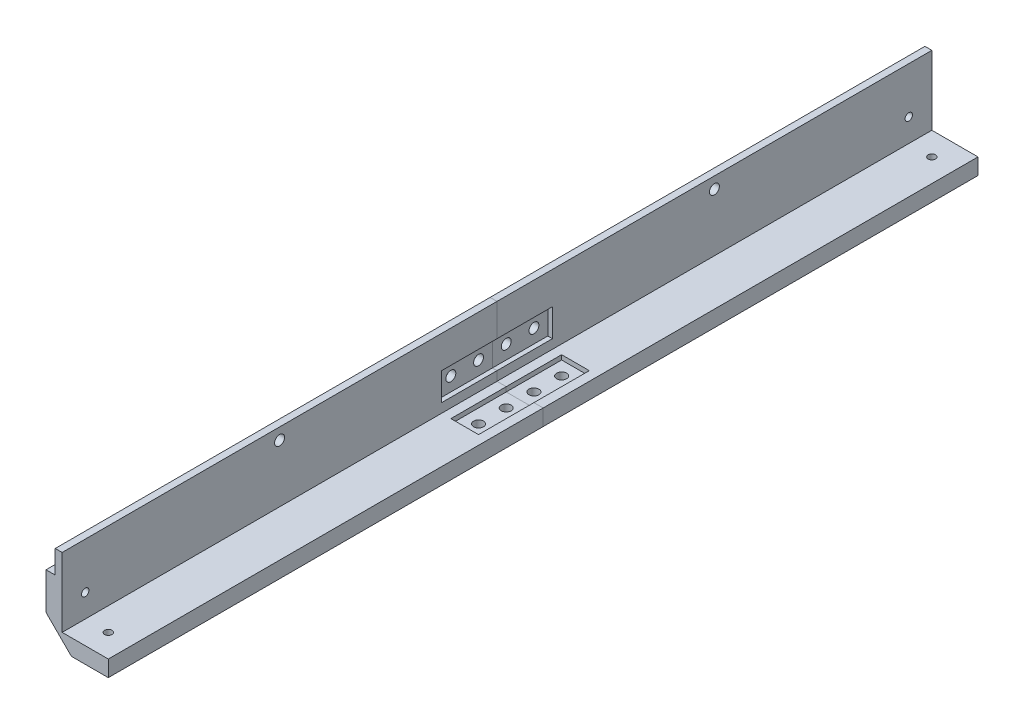
from build123d import *

# Parameters (mm, degrees)
BOSS_EXTRUDE1_DEPTH                = 188.45
FILLET1_R                          = 1.5
SKETCH6_W                          = 188.45
SKETCH6_H                          = 3
BOSS_EXTRUDE2_DEPTH                = 10
SKETCH7_W                          = 13
SKETCH7_H                          = 188.45
BOSS_EXTRUDE3_DEPTH                = 4
SKETCH8_W                          = 3
SKETCH8_H                          = 188.45
BOSS_EXTRUDE4_DEPTH                = 10
SKETCH9_W                          = 188.45
SKETCH9_H                          = 13
BOSS_EXTRUDE5_DEPTH                = 4
CSK_FOR_M3_SFHCS1_D                = 3.2
CSK_FOR_M3_SFHCS1_CSINK_D          = 6.72
CSK_FOR_M3_SFHCS1_CSINK_ANGLE      = 90
CSK_FOR_M3_SFHCS2_D                = 3.2
CSK_FOR_M3_SFHCS2_CSINK_D          = 6.72
CSK_FOR_M3_SFHCS2_CSINK_ANGLE      = 90
SKETCH14_W                         = 10
SKETCH14_H                         = 188.45
CUT_EXTRUDE1_DEPTH                 = 10
F_4_3_START                        = -3
F_4_3_4_3_DIAMETER_HOLE3_OUTLINE_R = 2.15
F_4_3_4_3_DIAMETER_HOLE3_DEPTH     = 3
SKETCH17_W                         = 12
SKETCH17_H                         = 48
CUT_EXTRUDE2_DEPTH                 = 2
SKETCH18_W                         = 48
SKETCH18_H                         = 12
CUT_EXTRUDE3_DEPTH                 = 2
F_4_3_START_2                      = -5
F_4_3_4_3_DIAMETER_HOLE1_OUTLINE_R = 2.15
F_4_3_4_3_DIAMETER_HOLE1_DEPTH     = 3
F_4_3_4_3_DIAMETER_HOLE2_OUTLINE_R = 2.15
F_4_3_4_3_DIAMETER_HOLE2_DEPTH     = 3


# Read off the part's stored shape, not the designer's step: Ø4.3 (4.3) Diameter Hole3, Ø4.3 (4.3) Diameter Hole1, Ø4.3 (4.3) Diameter Hole2
with BuildPart() as part:
    # Sketch1 → Boss-Extrude1 (new body)
    with BuildSketch(Plane.XY.offset(280)):
        Polygon((-7, 4), (4, -7), (7, -7), (7, -3), (20, -3), (20, 0), (0, 0), (0, 20), (-3, 20), (-3, 7), (-7, 7), align=None)
    extrude(amount=-BOSS_EXTRUDE1_DEPTH)

    # Fillet1
    fillet1_edges = [part.edges().sort_by_distance(p)[0] for p in [
        (4, -7, 185.775),
        (-7, 4, 185.775),
    ]]
    fillet(fillet1_edges, radius=FILLET1_R)

    # Sketch6 → Boss-Extrude2 (add)
    with BuildSketch(Plane(origin=(20, 0, 0), x_dir=(0, 0, -1), z_dir=(1, 0, 0))):
        with Locations((-185.775, -1.5)):
            Rectangle(SKETCH6_W, SKETCH6_H)
    extrude(amount=BOSS_EXTRUDE2_DEPTH)

    # Sketch7 → Boss-Extrude3 (add)
    with BuildSketch(Plane.XZ.offset(3)):
        with Locations((13.5, 185.775)):
            Rectangle(SKETCH7_W, SKETCH7_H)
    extrude(amount=BOSS_EXTRUDE3_DEPTH)

    # Sketch8 → Boss-Extrude4 (add)
    with BuildSketch(Plane(origin=(0, 20, 0), x_dir=(1, 0, 0), z_dir=(0, 1, 0))):
        with Locations((-1.5, -185.775)):
            Rectangle(SKETCH8_W, SKETCH8_H)
    extrude(amount=BOSS_EXTRUDE4_DEPTH)

    # Sketch9 → Boss-Extrude5 (add)
    with BuildSketch(Plane.ZY.offset(3)):
        with Locations((185.775, 13.5)):
            Rectangle(SKETCH9_W, SKETCH9_H)
    extrude(amount=BOSS_EXTRUDE5_DEPTH)

    # CSK for M3 SFHCS1 (through all)
    with Locations(Plane.XZ.offset(7)):
        with Locations((10, 270)):
            CounterSinkHole(CSK_FOR_M3_SFHCS1_D / 2, CSK_FOR_M3_SFHCS1_CSINK_D / 2, counter_sink_angle=CSK_FOR_M3_SFHCS1_CSINK_ANGLE)

    # CSK for M3 SFHCS2 (through all)
    with Locations(Plane.ZY.offset(7)):
        with Locations((270, 10)):
            CounterSinkHole(CSK_FOR_M3_SFHCS2_D / 2, CSK_FOR_M3_SFHCS2_CSINK_D / 2, counter_sink_angle=CSK_FOR_M3_SFHCS2_CSINK_ANGLE)

    # Sketch14 → Cut-Extrude1 (cut)
    with BuildSketch(Plane.XZ.offset(3)):
        with Locations((25, 185.775)):
            Rectangle(SKETCH14_W, SKETCH14_H)
    extrude(amount=-CUT_EXTRUDE1_DEPTH, mode=Mode.SUBTRACT)


with BuildPart() as body_2:
    # Mirror1: mirrored copy
    add(part.part.mirror(Plane.XY.offset(91.55)))


with BuildPart() as f_4_3_4_3_diameter_hole3_tool:
    # Ø4.3 (4.3) Diameter Hole3 outline → Ø4.3 (4.3) Diameter Hole3 (new body)
    with BuildSketch(Plane.YZ.offset(F_4_3_START)):
        with Locations((25, -2.675)):
            Circle(F_4_3_4_3_DIAMETER_HOLE3_OUTLINE_R)
        with Locations((25, 185.775)):
            Circle(F_4_3_4_3_DIAMETER_HOLE3_OUTLINE_R)
    extrude(amount=F_4_3_4_3_DIAMETER_HOLE3_DEPTH)


with BuildPart() as part_1:
    add(part.part)

    # Ø4.3 (4.3) Diameter Hole3: cut by f_4_3_4_3_diameter_hole3_tool
    add(f_4_3_4_3_diameter_hole3_tool.part, mode=Mode.SUBTRACT)


with BuildPart() as body_2_1:
    add(body_2.part)

    # Ø4.3 (4.3) Diameter Hole3: cut by f_4_3_4_3_diameter_hole3_tool
    add(f_4_3_4_3_diameter_hole3_tool.part, mode=Mode.SUBTRACT)


with BuildPart() as cut_extrude2_tool:
    # Sketch17 → Cut-Extrude2 (new body)
    with BuildSketch(Plane(origin=(0, 0, 0), x_dir=(1, 0, 0), z_dir=(0, 1, 0))):
        with Locations((10, -91.55)):
            Rectangle(SKETCH17_W, SKETCH17_H)
    extrude(amount=-CUT_EXTRUDE2_DEPTH)


with BuildPart() as part_2:
    add(part_1.part)

    # Cut-Extrude2: cut by cut_extrude2_tool
    add(cut_extrude2_tool.part, mode=Mode.SUBTRACT)


with BuildPart() as body_2_2:
    add(body_2_1.part)

    # Cut-Extrude2: cut by cut_extrude2_tool
    add(cut_extrude2_tool.part, mode=Mode.SUBTRACT)


with BuildPart() as cut_extrude3_tool:
    # Sketch18 → Cut-Extrude3 (new body)
    with BuildSketch(Plane(origin=(0, 0, 0), x_dir=(0, 0, -1), z_dir=(1, 0, 0))):
        with Locations((-91.55, 10)):
            Rectangle(SKETCH18_W, SKETCH18_H)
    extrude(amount=-CUT_EXTRUDE3_DEPTH)


with BuildPart() as part_3:
    add(part_2.part)

    # Cut-Extrude3: cut by cut_extrude3_tool
    add(cut_extrude3_tool.part, mode=Mode.SUBTRACT)


with BuildPart() as body_2_3:
    add(body_2_2.part)

    # Cut-Extrude3: cut by cut_extrude3_tool
    add(cut_extrude3_tool.part, mode=Mode.SUBTRACT)


with BuildPart() as f_4_3_4_3_diameter_hole1_tool:
    # Ø4.3 (4.3) Diameter Hole1 outline → Ø4.3 (4.3) Diameter Hole1 (new body)
    with BuildSketch(Plane(origin=(0, 0, 0), x_dir=(1, 0, 0), z_dir=(0, 1, 0)).offset(F_4_3_START_2)):
        with Locations((10, -73.55)):
            Circle(F_4_3_4_3_DIAMETER_HOLE1_OUTLINE_R)
        with Locations((10, -85.55)):
            Circle(F_4_3_4_3_DIAMETER_HOLE1_OUTLINE_R)
        with Locations((10, -109.55)):
            Circle(F_4_3_4_3_DIAMETER_HOLE1_OUTLINE_R)
        with Locations((10, -97.55)):
            Circle(F_4_3_4_3_DIAMETER_HOLE1_OUTLINE_R)
    extrude(amount=F_4_3_4_3_DIAMETER_HOLE1_DEPTH)


with BuildPart() as part_4:
    add(part_3.part)

    # Ø4.3 (4.3) Diameter Hole1: cut by f_4_3_4_3_diameter_hole1_tool
    add(f_4_3_4_3_diameter_hole1_tool.part, mode=Mode.SUBTRACT)


with BuildPart() as body_2_4:
    add(body_2_3.part)

    # Ø4.3 (4.3) Diameter Hole1: cut by f_4_3_4_3_diameter_hole1_tool
    add(f_4_3_4_3_diameter_hole1_tool.part, mode=Mode.SUBTRACT)


with BuildPart() as f_4_3_4_3_diameter_hole2_tool:
    # Ø4.3 (4.3) Diameter Hole2 outline → Ø4.3 (4.3) Diameter Hole2 (new body)
    with BuildSketch(Plane.YZ.offset(F_4_3_START_2)):
        with Locations((10, 73.55)):
            Circle(F_4_3_4_3_DIAMETER_HOLE2_OUTLINE_R)
        with Locations((10, 85.55)):
            Circle(F_4_3_4_3_DIAMETER_HOLE2_OUTLINE_R)
        with Locations((10, 97.55)):
            Circle(F_4_3_4_3_DIAMETER_HOLE2_OUTLINE_R)
        with Locations((10, 109.55)):
            Circle(F_4_3_4_3_DIAMETER_HOLE2_OUTLINE_R)
    extrude(amount=F_4_3_4_3_DIAMETER_HOLE2_DEPTH)


with BuildPart() as part_5:
    add(part_4.part)

    # Ø4.3 (4.3) Diameter Hole2: cut by f_4_3_4_3_diameter_hole2_tool
    add(f_4_3_4_3_diameter_hole2_tool.part, mode=Mode.SUBTRACT)


with BuildPart() as body_2_5:
    add(body_2_4.part)

    # Ø4.3 (4.3) Diameter Hole2: cut by f_4_3_4_3_diameter_hole2_tool
    add(f_4_3_4_3_diameter_hole2_tool.part, mode=Mode.SUBTRACT)


solid = Compound([part_5.part, body_2_5.part])
